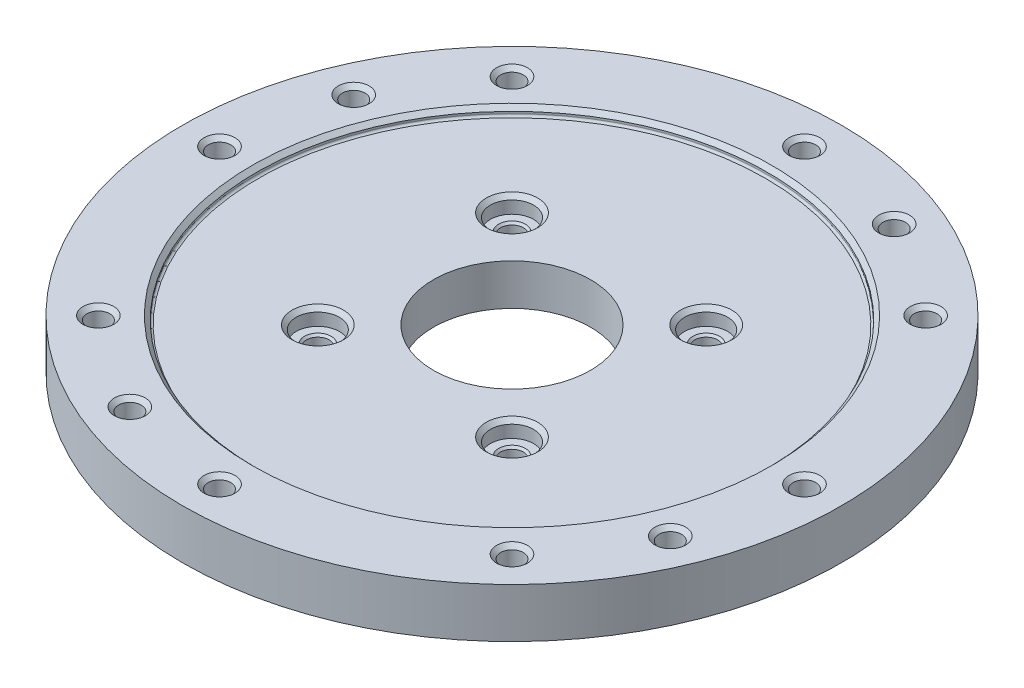
from build123d import *

# Parameters (mm, degrees)
SKETCH1_R           = 80
SKETCH1_R_2         = 19.075
BOSS_EXTRUDE1_DEPTH = 12
SKETCH2_R           = 2.75
CUT_EXTRUDE1_DEPTH  = 114.771701227
SKETCH3_R           = 5.25
CUT_EXTRUDE2_DEPTH  = 6
SKETCH4_R           = 62.1
CUT_EXTRUDE3_DEPTH  = 2
SKETCH5_R           = 2.75
CUT_EXTRUDE4_DEPTH  = 114.771701227
SKETCH8_R           = 7
SKETCH8_R_2         = 5.5
CUT_EXTRUDE5_DEPTH  = 5
FILLET1_R           = 0.5
CHAMFER1_SIZE       = 1
CHAMFER2_SIZE       = 1
CHAMFER3_SIZE       = 1
CHAMFER4_SIZE       = 0.5


with BuildPart() as part:
    # Sketch1 → Boss-Extrude1 (new body)
    with BuildSketch(Plane(origin=(0, 0, 0), x_dir=(1, 0, 0), z_dir=(0, 1, 0))):
        Circle(SKETCH1_R)
        Circle(SKETCH1_R_2, mode=Mode.SUBTRACT)
    extrude(amount=BOSS_EXTRUDE1_DEPTH)

    # Sketch2 → Cut-Extrude1 (cut, through all)
    with BuildSketch(Plane(origin=(0, 12, 0), x_dir=(1, 0, 0), z_dir=(0, 1, 0))):
        with Locations((-23.57, 23.57)):
            Circle(SKETCH2_R)
        with Locations((23.57, 23.57)):
            Circle(SKETCH2_R)
        with Locations((-23.57, -23.57)):
            Circle(SKETCH2_R)
        with Locations((23.57, -23.57)):
            Circle(SKETCH2_R)
    extrude(amount=-CUT_EXTRUDE1_DEPTH, mode=Mode.SUBTRACT)

    # Sketch3 → Cut-Extrude2 (cut)
    with BuildSketch(Plane(origin=(0, 12, 0), x_dir=(1, 0, 0), z_dir=(0, 1, 0))):
        with Locations((-23.57, 23.57)):
            Circle(SKETCH3_R)
        with Locations((23.57, 23.57)):
            Circle(SKETCH3_R)
        with Locations((-23.57, -23.57)):
            Circle(SKETCH3_R)
        with Locations((23.57, -23.57)):
            Circle(SKETCH3_R)
    extrude(amount=-CUT_EXTRUDE2_DEPTH, mode=Mode.SUBTRACT)

    # Sketch4 → Cut-Extrude3 (cut)
    with BuildSketch(Plane(origin=(0, 12, 0), x_dir=(1, 0, 0), z_dir=(0, 1, 0))):
        Circle(SKETCH4_R)
    extrude(amount=-CUT_EXTRUDE3_DEPTH, mode=Mode.SUBTRACT)

    # Sketch5 → Cut-Extrude4 (cut, through all)
    with BuildSketch(Plane(origin=(0, 12, 0), x_dir=(1, 0, 0), z_dir=(0, 1, 0))):
        with Locations((0, 71)):
            Circle(SKETCH5_R)
        with Locations((27.170523698, 65.595446808)):
            Circle(SKETCH5_R)
        with Locations((50.204581464, 50.204581464)):
            Circle(SKETCH5_R)
        with Locations((71, 0)):
            Circle(SKETCH5_R)
        with Locations((50.204581464, -50.204581464)):
            Circle(SKETCH5_R)
        with Locations((0, -71)):
            Circle(SKETCH5_R)
        with Locations((-50.204581464, -50.204581464)):
            Circle(SKETCH5_R)
        with Locations((-71, 0)):
            Circle(SKETCH5_R)
        with Locations((-50.204581464, 50.204581464)):
            Circle(SKETCH5_R)
        with Locations((65.595446808, -27.170523698)):
            Circle(SKETCH5_R)
        with Locations((-27.170523698, -65.595446808)):
            Circle(SKETCH5_R)
        with Locations((-65.595446808, 27.170523698)):
            Circle(SKETCH5_R)
    extrude(amount=-CUT_EXTRUDE4_DEPTH, mode=Mode.SUBTRACT)

    # Sketch8 → Cut-Extrude5 (cut)
    # profile 1 of 8: a face of its own
    with BuildSketch(Plane.XZ):
        with Locations((50.204581464, 50.204581464)):
            Circle(SKETCH8_R)
    # profile 2 of 8: a face of its own
    with BuildSketch(Plane.XZ):
        with Locations((0, 71)):
            Circle(SKETCH8_R)
    # profile 3 of 8: a face of its own
    with BuildSketch(Plane.XZ):
        with Locations((71, 0)):
            Circle(SKETCH8_R)
    # profile 4 of 8: a face of its own
    with BuildSketch(Plane.XZ):
        with Locations((50.204581464, -50.204581464)):
            Circle(SKETCH8_R)
        with Locations((50.204581464, -50.204581464)):
            Circle(SKETCH8_R_2, mode=Mode.SUBTRACT)
    # profile 5 of 8: a face of its own
    with BuildSketch(Plane.XZ):
        with Locations((0, -71)):
            Circle(SKETCH8_R)
    # profile 6 of 8: a face of its own
    with BuildSketch(Plane.XZ):
        with Locations((-71, 0)):
            Circle(SKETCH8_R)
    # profile 7 of 8: a face of its own
    with BuildSketch(Plane.XZ):
        with Locations((-50.204581464, 50.204581464)):
            Circle(SKETCH8_R)
    # profile 8 of 8: a face of its own
    with BuildSketch(Plane.XZ):
        with Locations((-50.204581464, -50.204581464)):
            Circle(SKETCH8_R)
    extrude(amount=-CUT_EXTRUDE5_DEPTH, mode=Mode.SUBTRACT)

    # Fillet1
    fillet1_edges = [part.edges().sort_by_distance(p)[0] for p in [
        (-62.1, 10, 0),
    ]]
    fillet(fillet1_edges, radius=FILLET1_R)

    # Chamfer1
    chamfer1_edges = [part.edges().sort_by_distance(p)[0] for p in [
        (-62.1, 12, 0),
    ]]
    chamfer(chamfer1_edges, length=CHAMFER1_SIZE)

    # Chamfer2
    chamfer2_edges = [part.edges().sort_by_distance(p)[0] for p in [
        (47.454581464, 12, 50.204581464),
        (-52.954581464, 12, 50.204581464),
        (-2.75, 12, 71),
        (68.25, 12, 0),
        (47.454581464, 12, -50.204581464),
        (24.420523698, 12, -65.595446808),
        (-2.75, 12, -71),
        (-73.75, 12, 0),
        (-28.82, 10, -23.57),
        (18.32, 10, -23.57),
        (18.32, 10, 23.57),
        (-28.82, 10, 23.57),
        (-52.954581464, 5, -50.204581464),
        (-29.920523698, 0, 65.595446808),
        (62.845446808, 0, 27.170523698),
        (24.420523698, 0, -65.595446808),
        (-68.345446808, 0, -27.170523698),
        (62.845446808, 12, 27.170523698),
        (-29.920523698, 12, 65.595446808),
        (-52.954581464, 12, -50.204581464),
        (-68.345446808, 12, -27.170523698),
    ]]
    chamfer(chamfer2_edges, length=CHAMFER2_SIZE)

    # Chamfer3
    chamfer3_edges = [part.edges().sort_by_distance(p)[0] for p in [
        (43.204581464, 0, 50.204581464),
        (64, 0, 0),
        (44.704581464, 0, -50.204581464),
        (43.204581464, 0, -50.204581464),
        (-7, 0, -71),
        (-78, 0, 0),
        (-57.204581464, 0, 50.204581464),
        (-7, 0, 71),
        (-57.204581464, 0, -50.204581464),
    ]]
    chamfer(chamfer3_edges, length=CHAMFER3_SIZE)

    # Chamfer4
    chamfer4_edges = [part.edges().sort_by_distance(p)[0] for p in [
        (-26.32, 6, 23.57),
        (20.82, 6, 23.57),
        (20.82, 6, -23.57),
        (-26.32, 6, -23.57),
    ]]
    chamfer(chamfer4_edges, length=CHAMFER4_SIZE)


solid = part.part
